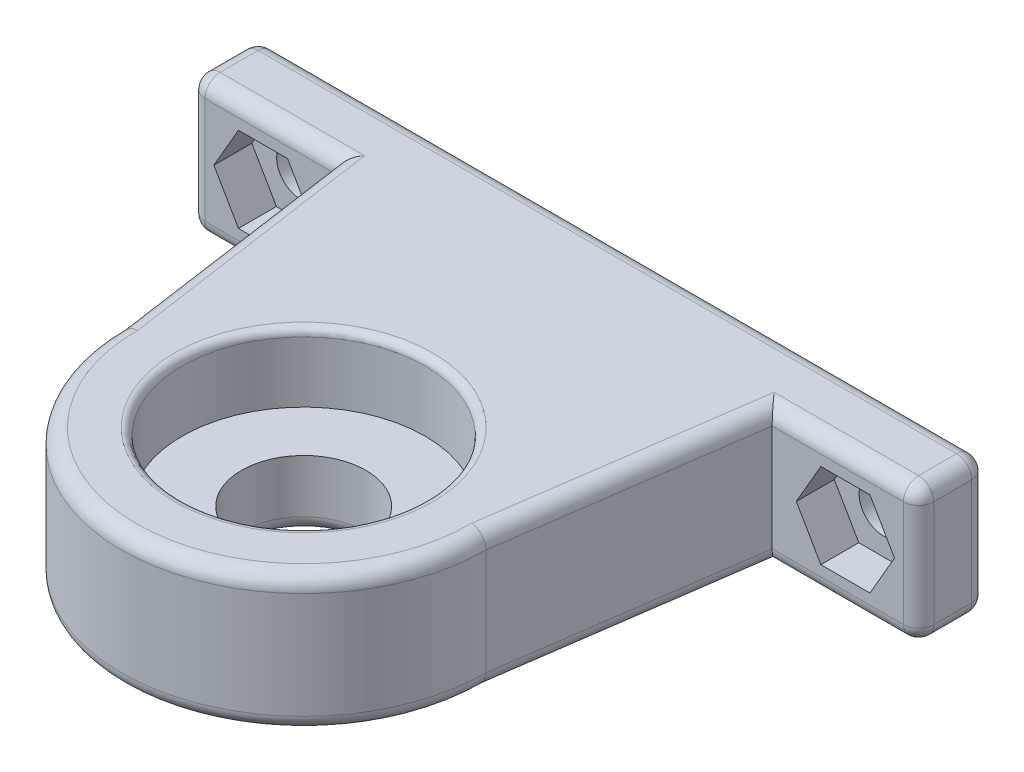
from build123d import *

# Parameters (mm, degrees)
CROQUIS1_R              = 4.1
SALIENTE_EXTRUIR2_DEPTH = 9
CORTAR_EXTRUIR1_START   = -4.5
CROQUIS2_R              = 8
CROQUIS2_R_2            = 4.1
CORTAR_EXTRUIR1_DEPTH   = 4.5
CORTAR_EXTRUIR3_DEPTH   = 2.5
CORTAR_EXTRUIR4_DEPTH   = 2.5
CROQUIS5_R              = 1.6
CORTAR_EXTRUIR5_DEPTH   = 2.5
REDONDEO1_R             = 1
REDONDEO2_R             = 0.5


with BuildPart() as part:
    # Croquis1 → Saliente-Extruir2 (new body)
    with BuildSketch(Plane(origin=(0, 0, 0), x_dir=(1, 0, 0), z_dir=(0, 1, 0))):
        with BuildLine():
            Line((-12.502682763, 9.643192488), (-10.145539906, -6.856807512))
            ThreePointArc((-10.145539906, -6.856807512), (1.854460094, -18.856807512), (13.854460094, -6.856807512))
            Line((13.854460094, -6.856807512), (16.211602951, 9.643192488))
            Line((16.211602951, 9.643192488), (25.854460094, 9.643192488))
            Line((25.854460094, 9.643192488), (25.854460094, 14.143192488))
            Line((25.854460094, 14.143192488), (-22.145539906, 14.143192488))
            Line((-22.145539906, 14.143192488), (-22.145539906, 9.643192488))
            Line((-22.145539906, 9.643192488), (-12.502682763, 9.643192488))
        make_face()
        with Locations((1.854460094, -6.856807512)):
            Circle(CROQUIS1_R, mode=Mode.SUBTRACT)
    extrude(amount=SALIENTE_EXTRUIR2_DEPTH)

    # Croquis2 → Cortar-Extruir1 (cut)
    with BuildSketch(Plane(origin=(0, 9, 0), x_dir=(1, 0, 0), z_dir=(0, 1, 0)).offset(CORTAR_EXTRUIR1_START)):
        with Locations((1.854460094, -6.856807512)):
            Circle(CROQUIS2_R)
        with Locations((1.854460094, -6.856807512)):
            Circle(CROQUIS2_R_2, mode=Mode.SUBTRACT)
    extrude(amount=CORTAR_EXTRUIR1_DEPTH, mode=Mode.SUBTRACT)

    # Croquis3 → Cortar-Extruir3 (cut)
    with BuildSketch(Plane.XY.offset(-9.643192488)):
        Polygon((-14.090949827, 4.5), (-15.707530581, 7.3), (-18.940692088, 7.3), (-20.557272842, 4.5), (-18.940692088, 1.7), (-15.707530581, 1.7), align=None)
    extrude(amount=-CORTAR_EXTRUIR3_DEPTH, mode=Mode.SUBTRACT)

    # Croquis4 → Cortar-Extruir4 (cut)
    with BuildSketch(Plane.XY.offset(-9.643192488)):
        Polygon((24.26619303, 4.5), (22.649612276, 7.3), (19.416450769, 7.3), (17.799870015, 4.5), (19.416450769, 1.7), (22.649612276, 1.7), align=None)
    extrude(amount=-CORTAR_EXTRUIR4_DEPTH, mode=Mode.SUBTRACT)

    # Croquis5 → Cortar-Extruir5 (cut)
    with BuildSketch(Plane.XY.offset(-12.143192488)):
        with Locations((21.033031522, 4.5)):
            Circle(CROQUIS5_R)
        with Locations((-17.324111335, 4.5)):
            Circle(CROQUIS5_R)
    extrude(amount=-CORTAR_EXTRUIR5_DEPTH, mode=Mode.SUBTRACT)

    # Redondeo1
    redondeo1_edges = [part.edges().sort_by_distance(p)[0] for p in [
        (-2.245539906, 0, 6.856807512),
        (-17.324111335, 0, -9.643192488),
        (-11.324111335, 0, -1.393192488),
        (1.854460094, 0, 18.856807512),
        (15.033031522, 0, -1.393192488),
        (21.033031522, 0, -9.643192488),
        (1.854460094, 0, -14.143192488),
        (21.033031522, 9, -9.643192488),
        (15.033031522, 9, -1.393192488),
        (1.854460094, 9, 18.856807512),
        (-11.324111335, 9, -1.393192488),
        (-17.324111335, 9, -9.643192488),
        (1.854460094, 9, -14.143192488),
        (25.854460094, 9, -11.893192488),
        (-22.145539906, 9, -11.893192488),
        (-22.145539906, 0, -11.893192488),
        (25.854460094, 0, -11.893192488),
        (-22.145539906, 4.5, -9.643192488),
        (-22.145539906, 4.5, -14.143192488),
        (25.854460094, 4.5, -9.643192488),
        (25.854460094, 4.5, -14.143192488),
    ]]
    fillet(redondeo1_edges, radius=REDONDEO1_R)

    # Redondeo2
    redondeo2_edges = [part.edges().sort_by_distance(p)[0] for p in [
        (-6.145539906, 9, 6.856807512),
    ]]
    fillet(redondeo2_edges, radius=REDONDEO2_R)


solid = part.part
